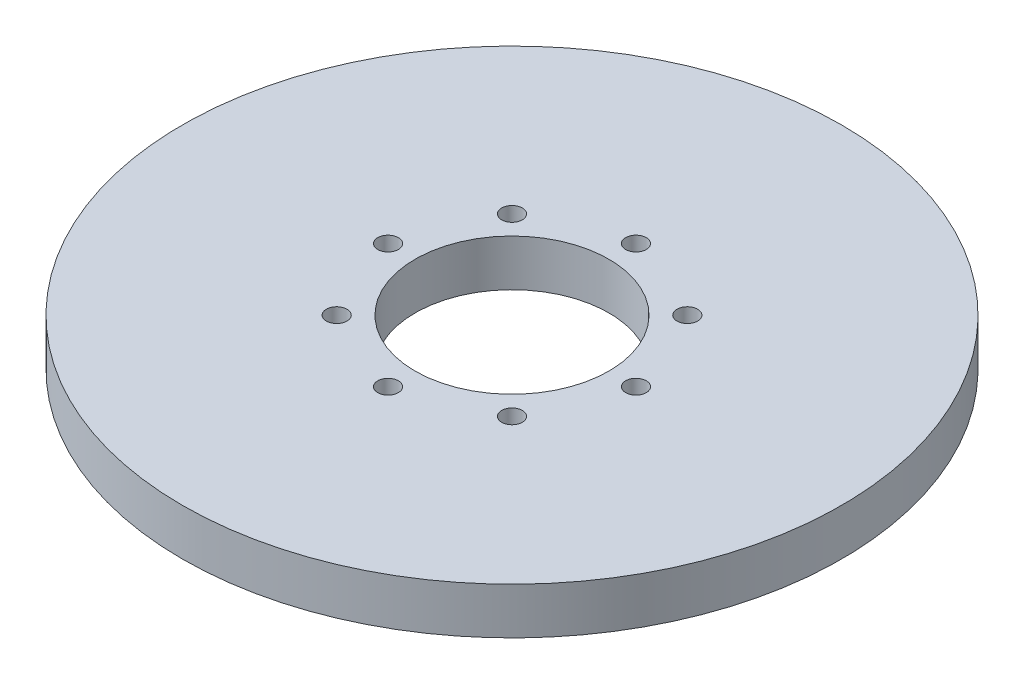
from build123d import *

# Parameters (mm, degrees)
SKETCH1_R           = 85
BOSS_EXTRUDE1_DEPTH = 12
SKETCH2_R           = 25
CUT_EXTRUDE1_DEPTH  = 121.805629008
SKETCH3_R           = 2.661281078
CUT_EXTRUDE2_DEPTH  = 11.7308905
CIRPATTERN1_COUNT   = 8


with BuildPart() as part:
    # Sketch1 → Boss-Extrude1 (new body)
    with BuildSketch(Plane(origin=(0, 0, 0), x_dir=(1, 0, 0), z_dir=(0, 1, 0))):
        Circle(SKETCH1_R)
    extrude(amount=BOSS_EXTRUDE1_DEPTH)

    # Sketch2 → Cut-Extrude1 (cut, through all)
    with BuildSketch(Plane(origin=(0, 0, 0), x_dir=(1, 0, 0), z_dir=(0, 1, 0))):
        Circle(SKETCH2_R)
    extrude(amount=CUT_EXTRUDE1_DEPTH, mode=Mode.SUBTRACT)

    # Sketch3 → Cut-Extrude2 (cut)
    with BuildSketch(Plane(origin=(0, 12, 0), x_dir=(1, 0, 0), z_dir=(0, 1, 0))):
        with Locations((-31.973633211, 0)):
            Circle(SKETCH3_R)
    cut_extrude2 = extrude(amount=-CUT_EXTRUDE2_DEPTH, mode=Mode.SUBTRACT)

    # CirPattern1: Cut-Extrude2 ×8 about axis
    cirpattern1_axis = Axis((0, 0, 0), (0, 1, 0))
    for i in range(1, CIRPATTERN1_COUNT):
        add(cut_extrude2.rotate(cirpattern1_axis, i * 360 / CIRPATTERN1_COUNT), mode=Mode.SUBTRACT)


solid = part.part
